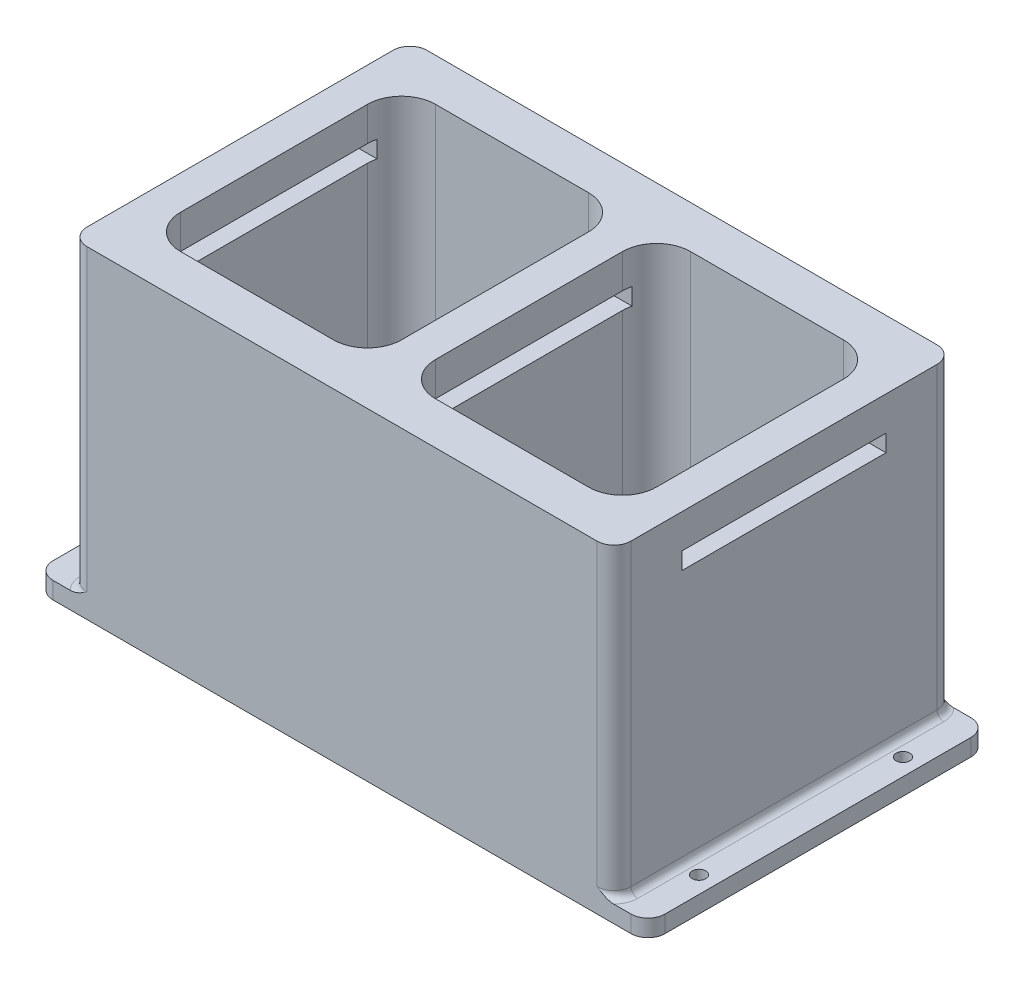
from build123d import *

# Parameters (mm, degrees)
SKETCH1_W               = 180
SKETCH1_H               = 100
BOSS_EXTRUDE1_DEPTH     = 5
SKETCH2_W               = 160
SKETCH2_H               = 100
BOSS_EXTRUDE2_DEPTH     = 90
SKETCH3_R               = 2
CUT_EXTRUDE1_DEPTH      = 137.747943312
FILLET1_R               = 5
FILLET2_R               = 2
SKETCH4_W               = 65
SKETCH4_H               = 75
CUT_EXTRUDE2_DEPTH      = 85
FILLET3_R               = 10
CUT_EXTRUDE3_DEPTH      = 202.059692701
CUT_EXTRUDE3_DEPTH_BACK = 202.059692701
SKETCH5_W               = 60
SKETCH5_H               = 5


with BuildPart() as part:
    # Sketch1 → Boss-Extrude1 (new body)
    with BuildSketch(Plane(origin=(0, 0, 0), x_dir=(1, 0, 0), z_dir=(0, 1, 0))):
        Rectangle(SKETCH1_W, SKETCH1_H)
    extrude(amount=BOSS_EXTRUDE1_DEPTH)

    # Sketch2 → Boss-Extrude2 (add)
    with BuildSketch(Plane(origin=(0, 5, 0), x_dir=(1, 0, 0), z_dir=(0, 1, 0))):
        Rectangle(SKETCH2_W, SKETCH2_H)
    extrude(amount=BOSS_EXTRUDE2_DEPTH)

    # Sketch3 → Cut-Extrude1 (cut, through all)
    with BuildSketch(Plane(origin=(0, 5, 0), x_dir=(1, 0, 0), z_dir=(0, 1, 0))):
        with Locations(Location((-85, 30, 0), (0, 0, 270))):
            Circle(SKETCH3_R)
        with Locations(Location((85, 30, 0), (0, 0, 90))):
            Circle(SKETCH3_R)
        with Locations(Location((85, -30, 0), (0, 0, 270))):
            Circle(SKETCH3_R)
        with Locations(Location((-85, -30, 0), (0, 0, 90))):
            Circle(SKETCH3_R)
    extrude(amount=-CUT_EXTRUDE1_DEPTH, mode=Mode.SUBTRACT)

    # Fillet1
    fillet1_edges = [part.edges().sort_by_distance(p)[0] for p in [
        (-80, 50, -50),
        (-80, 50, 50),
        (80, 50, 50),
        (80, 50, -50),
        (-90, 2.5, -50),
        (90, 2.5, -50),
        (90, 2.5, 50),
        (-90, 2.5, 50),
    ]]
    fillet(fillet1_edges, radius=FILLET1_R)

    # Fillet2
    # the kernel refuses this fillet: 2 mm, written as the material it adds along each edge
    with BuildSketch(Plane(origin=(-80, 5, 45), x_dir=(0, 1, 0), z_dir=(0, 0, -1)), Plane(origin=(80, 5, -45), x_dir=(0, 1, 0), z_dir=(0, 0, 1))) as fillet2_piece_1:
        with BuildLine():
            CenterArc((FILLET2_R, -FILLET2_R), FILLET2_R, 90, 90)
            Line((0, -FILLET2_R), (0, 0))
            Line((0, 0), (FILLET2_R, 0))
        make_face()
    extrude(amount=90)
    with BuildSketch(Plane(origin=(-75, 5, -45), x_dir=(-1, 0, 0), z_dir=(0, 0, 1))) as fillet2_piece_2_section:
        with BuildLine():
            CenterArc((5 + FILLET2_R, -FILLET2_R), FILLET2_R, 90, 90)
            Line((5 + FILLET2_R, 0), (5, 0))
            Line((5, 0), (5, -FILLET2_R))
        make_face()
    fillet2_piece_2 = revolve(axis=Axis((-75, 5, -45), (0, -1, 0)), revolution_arc=147.318795695, mode=Mode.PRIVATE)
    fillet2_piece_2 = split(fillet2_piece_2, bisect_by=Plane(origin=(-78.61306887, 5.526930213, -50), z_dir=(0, 0, 1)), keep=Keep.TOP, mode=Mode.PRIVATE)
    add(fillet2_piece_2)
    with BuildSketch(Plane(origin=(75, 5, -45), x_dir=(1, 0, 0), z_dir=(0, 0, 1))) as fillet2_piece_3_section:
        with BuildLine():
            CenterArc((5 + FILLET2_R, FILLET2_R), FILLET2_R, 180, 90)
            Line((5 + FILLET2_R, 0), (5, 0))
            Line((5, 0), (5, FILLET2_R))
        make_face()
    fillet2_piece_3 = revolve(axis=Axis((75, 5, -45), (0, 1, 0)), revolution_arc=147.318795695, mode=Mode.PRIVATE)
    fillet2_piece_3 = split(fillet2_piece_3, bisect_by=Plane(origin=(78.613069351, 5.526929856, -50), z_dir=(0, 0, 1)), keep=Keep.TOP, mode=Mode.PRIVATE)
    add(fillet2_piece_3)
    with BuildSketch(Plane(origin=(-75, 5, 45), x_dir=(0.8416879607506224, 0, 0.5399642365263265), z_dir=(0.5399642365263265, 0, -0.8416879607506224))) as fillet2_piece_4_section:
        with BuildLine():
            CenterArc((5 + FILLET2_R, -FILLET2_R), FILLET2_R, 90, 90)
            Line((5, -FILLET2_R), (5, 0))
            Line((5, 0), (5 + FILLET2_R, 0))
        make_face()
    fillet2_piece_4 = revolve(axis=Axis((-75, 5, 45), (0, -1, 0)), revolution_arc=147.318795695, mode=Mode.PRIVATE)
    fillet2_piece_4 = split(fillet2_piece_4, bisect_by=Plane(origin=(-78.614624166, 5.52723882, 50), z_dir=(0, 0, -1)), keep=Keep.TOP, mode=Mode.PRIVATE)
    add(fillet2_piece_4)
    with BuildSketch(Plane(origin=(75, 5, 45), x_dir=(-0.8416879607506224, 0, 0.5399642365263265), z_dir=(-0.5399642365263265, 0, -0.8416879607506224))) as fillet2_piece_5_section:
        with BuildLine():
            CenterArc((5 + FILLET2_R, FILLET2_R), FILLET2_R, 180, 90)
            Line((5 + FILLET2_R, 0), (5, 0))
            Line((5, 0), (5, FILLET2_R))
        make_face()
    fillet2_piece_5 = revolve(axis=Axis((75, 5, 45), (0, 1, 0)), revolution_arc=147.318795695, mode=Mode.PRIVATE)
    fillet2_piece_5 = split(fillet2_piece_5, bisect_by=Plane(origin=(78.613068706, 5.526930627, 50), z_dir=(0, 0, -1)), keep=Keep.TOP, mode=Mode.PRIVATE)
    add(fillet2_piece_5)

    # Sketch4 → Cut-Extrude2 (cut)
    with BuildSketch(Plane(origin=(0, 95, 0), x_dir=(1, 0, 0), z_dir=(0, 1, 0))):
        with Locations((-37.5, 0)):
            Rectangle(SKETCH4_W, SKETCH4_H)
        with Locations((37.5, 0)):
            Rectangle(SKETCH4_W, SKETCH4_H)
    extrude(amount=-CUT_EXTRUDE2_DEPTH, mode=Mode.SUBTRACT)

    # Fillet3
    fillet3_edges = [part.edges().sort_by_distance(p)[0] for p in [
        (-70, 52.5, 37.5),
        (-70, 52.5, -37.5),
        (-5, 52.5, -37.5),
        (-5, 52.5, 37.5),
        (5, 52.5, 37.5),
        (5, 52.5, -37.5),
        (70, 52.5, -37.5),
        (70, 52.5, 37.5),
    ]]
    fillet(fillet3_edges, radius=FILLET3_R)

    # Sketch5 → Cut-Extrude3 (cut, two sides: drawn at the far end of the back side and taken through both)
    with BuildSketch(Plane.ZY.offset(80).offset(-CUT_EXTRUDE3_DEPTH_BACK)):
        with Locations((0, 82.5)):
            Rectangle(SKETCH5_W, SKETCH5_H)
    extrude(amount=CUT_EXTRUDE3_DEPTH + CUT_EXTRUDE3_DEPTH_BACK, mode=Mode.SUBTRACT)


solid = part.part
